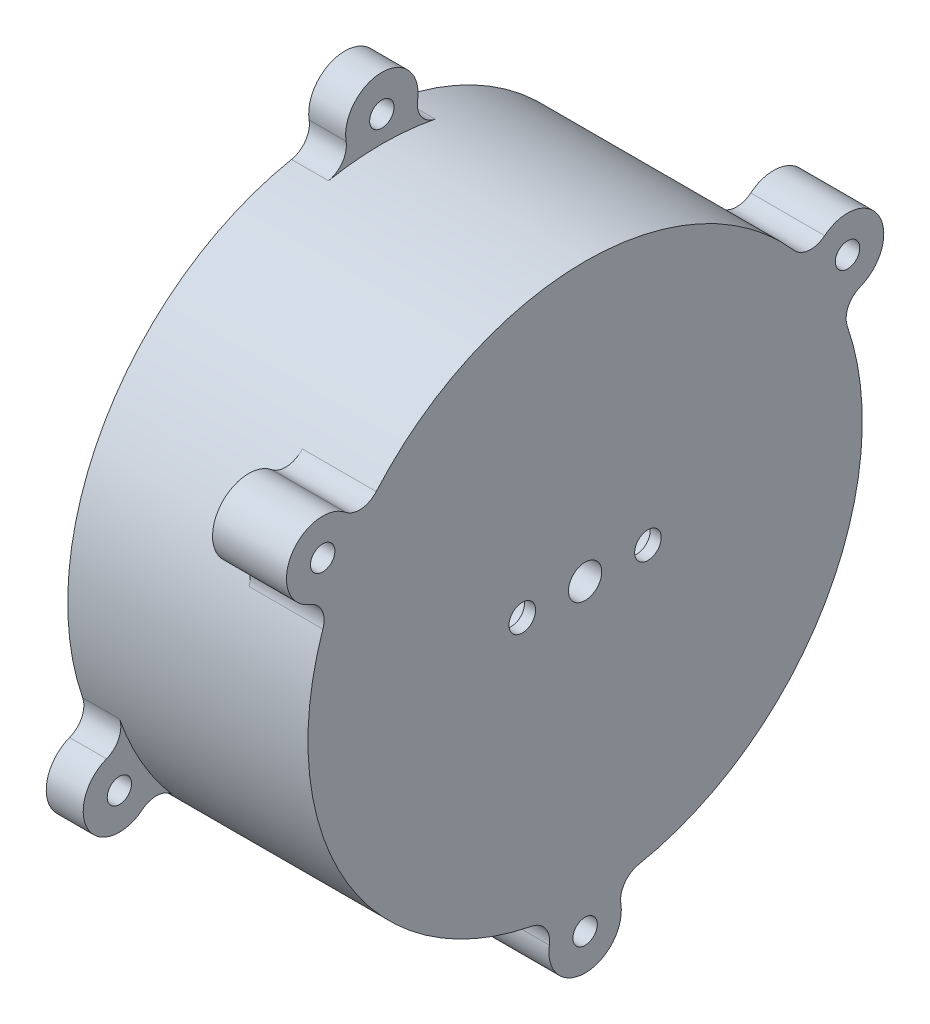
from build123d import *

# Parameters (mm, degrees)
BASPROSKE_W         = 28
BASPROSKE_H         = 4.375
TOOTHCUT_DEPTH      = 60.970826241
TEETHCUTS_COUNT     = 55
TEETHCUTS_ANGLE     = 353.454545455
BOSS_EXTRUDE1_START = 4.5
SKETCH1_R           = 37.5
BOSS_EXTRUDE1_DEPTH = 4.5
SKETCH2_R           = 2.25
SKETCH2_R_2         = 1.8
CUT_EXTRUDE1_DEPTH  = 4.5
SKETCH3_R           = 3.25
CUT_EXTRUDE2_DEPTH  = 3
BOSS_EXTRUDE2_START = -5
SKETCH4_R           = 1.65
BOSS_EXTRUDE2_DEPTH = 5
FILLET1_R           = 3
SKETCH5_R           = 1.65
BOSS_EXTRUDE3_DEPTH = 10
FILLET2_R           = 3


with BuildPart() as part:
    # BasProSke → Base-Revolve (revolve)
    with BuildSketch(Plane(origin=(0, 0, 0), x_dir=(1, 0, 0), z_dir=(0, 1, 0))):
        with Locations((14, 35.3125)):
            Rectangle(BASPROSKE_W, BASPROSKE_H)
    revolve(axis=Axis((-10, 0, 0), (1, 0, 0)))

    # TooCutSke → ToothCut (cut, through all)
    with BuildSketch(Plane(origin=(0, 0, 0), x_dir=(0, 0, -1), z_dir=(1, 0, 0))):
        with BuildLine():
            ThreePointArc((1.451447951, 33.067761022), (1.040603726, 34.522224287), (0.503573985, 35.934971761))
            ThreePointArc((0.503573985, 35.934971761), (0, 35.9385), (-0.503573985, 35.934971761))
            ThreePointArc((-0.503573985, 35.934971761), (-1.040603726, 34.522224287), (-1.451447951, 33.067761022))
            ThreePointArc((-1.451447951, 33.067761022), (0, 33.0996), (1.451447951, 33.067761022))
        make_face()
    toothcut = extrude(amount=TOOTHCUT_DEPTH, mode=Mode.SUBTRACT)

    # TeethCuts: ToothCut ×55 about axis
    teethcuts_axis = Axis((-10, 0, 0), (1, 0, 0))
    for i in range(1, TEETHCUTS_COUNT):
        add(toothcut.rotate(teethcuts_axis, i * TEETHCUTS_ANGLE / (TEETHCUTS_COUNT - 1)), mode=Mode.SUBTRACT)

    # Sketch1 → Boss-Extrude1 (add)
    with BuildSketch(Plane(origin=(28, 0, 0), x_dir=(0, 0, -1), z_dir=(1, 0, 0)).offset(BOSS_EXTRUDE1_START)):
        Circle(SKETCH1_R)
    extrude(amount=-BOSS_EXTRUDE1_DEPTH)

    # Sketch2 → Cut-Extrude1 (cut)
    with BuildSketch(Plane(origin=(32.5, 0, 0), x_dir=(0, 0, -1), z_dir=(1, 0, 0))):
        Circle(SKETCH2_R)
        with Locations((-8.5, 0)):
            Circle(SKETCH2_R_2)
        with Locations((8.5, 0)):
            Circle(SKETCH2_R_2)
    extrude(amount=-CUT_EXTRUDE1_DEPTH, mode=Mode.SUBTRACT)

    # Sketch3 → Cut-Extrude2 (cut)
    with BuildSketch(Plane.ZY.offset(-28)):
        with Locations((-8.5, 0)):
            Circle(SKETCH3_R)
        with Locations((8.5, 0)):
            Circle(SKETCH3_R)
    extrude(amount=-CUT_EXTRUDE2_DEPTH, mode=Mode.SUBTRACT)

    # Sketch4 → Boss-Extrude2 (add)
    # profile 1 of 3: a face of its own
    with BuildSketch(Plane.ZY.offset(BOSS_EXTRUDE2_START)):
        with BuildLine():
            ThreePointArc((-3.276511835, 37.356585366), (0, 45.9), (3.276511835, 37.356585366))
            ThreePointArc((3.276511835, 37.356585366), (0, 37.5), (-3.276511835, 37.356585366))
        make_face()
        with Locations((0, 41)):
            Circle(SKETCH4_R, mode=Mode.SUBTRACT)
    # profile 2 of 3: a face of its own
    with BuildSketch(Plane.ZY.offset(BOSS_EXTRUDE2_START)):
        with BuildLine():
            ThreePointArc((33.990007843, -15.840750198), (39.750566034, -22.95), (30.713496008, -21.515835168))
            ThreePointArc((30.713496008, -21.515835168), (32.475952642, -18.75), (33.990007843, -15.840750198))
        make_face()
        with Locations((35.507041555, -20.5)):
            Circle(SKETCH4_R, mode=Mode.SUBTRACT)
    # profile 3 of 3: a face of its own
    with BuildSketch(Plane.ZY.offset(BOSS_EXTRUDE2_START)):
        with BuildLine():
            ThreePointArc((-30.713496008, -21.515835168), (-39.750566034, -22.95), (-33.990007843, -15.840750198))
            ThreePointArc((-33.990007843, -15.840750198), (-32.475952642, -18.75), (-30.713496008, -21.515835168))
        make_face()
        with Locations((-35.507041555, -20.5)):
            Circle(SKETCH4_R, mode=Mode.SUBTRACT)
    extrude(amount=BOSS_EXTRUDE2_DEPTH)

    # Fillet1
    fillet1_edges = [part.edges().sort_by_distance(p)[0] for p in [
        (2.5, -21.515835168, -30.713496008),
        (2.5, -21.515835168, 30.713496008),
        (2.5, -15.840750198, 33.990007843),
        (2.5, 37.356585366, 3.276511835),
        (2.5, -15.840750198, -33.990007843),
        (2.5, 37.356585366, -3.276511835),
    ]]
    fillet(fillet1_edges, radius=FILLET1_R)

    # Sketch5 → Boss-Extrude3 (add)
    # profile 1 of 3: a face of its own
    with BuildSketch(Plane(origin=(32.5, 0, 0), x_dir=(0, 0, -1), z_dir=(1, 0, 0))):
        with BuildLine():
            ThreePointArc((33.990007843, 15.840750198), (39.750566034, 22.95), (30.713496008, 21.515835168))
            ThreePointArc((30.713496008, 21.515835168), (32.475952642, 18.75), (33.990007843, 15.840750198))
        make_face()
        with Locations((35.507041555, 20.5)):
            Circle(SKETCH5_R, mode=Mode.SUBTRACT)
    # profile 2 of 3: a face of its own
    with BuildSketch(Plane(origin=(32.5, 0, 0), x_dir=(0, 0, -1), z_dir=(1, 0, 0))):
        with BuildLine():
            ThreePointArc((-3.276511835, -37.356585366), (0, -45.9), (3.276511835, -37.356585366))
            ThreePointArc((3.276511835, -37.356585366), (0, -37.5), (-3.276511835, -37.356585366))
        make_face()
        with Locations((0, -41)):
            Circle(SKETCH5_R, mode=Mode.SUBTRACT)
    # profile 3 of 3: a face of its own
    with BuildSketch(Plane(origin=(32.5, 0, 0), x_dir=(0, 0, -1), z_dir=(1, 0, 0))):
        with BuildLine():
            ThreePointArc((-30.713496008, 21.515835168), (-39.750566034, 22.95), (-33.990007843, 15.840750198))
            ThreePointArc((-33.990007843, 15.840750198), (-32.475952642, 18.75), (-30.713496008, 21.515835168))
        make_face()
        with Locations((-35.507041555, 20.5)):
            Circle(SKETCH5_R, mode=Mode.SUBTRACT)
    extrude(amount=-BOSS_EXTRUDE3_DEPTH)

    # Fillet2
    fillet2_edges = [part.edges().sort_by_distance(p)[0] for p in [
        (27.5, 15.840750198, 33.990007843),
        (27.5, -37.356585366, 3.276511835),
        (27.5, -37.356585366, -3.276511835),
        (27.5, 21.515835168, 30.713496008),
        (27.5, 15.840750198, -33.990007843),
        (27.5, 21.515835168, -30.713496008),
    ]]
    fillet(fillet2_edges, radius=FILLET2_R)


solid = part.part
